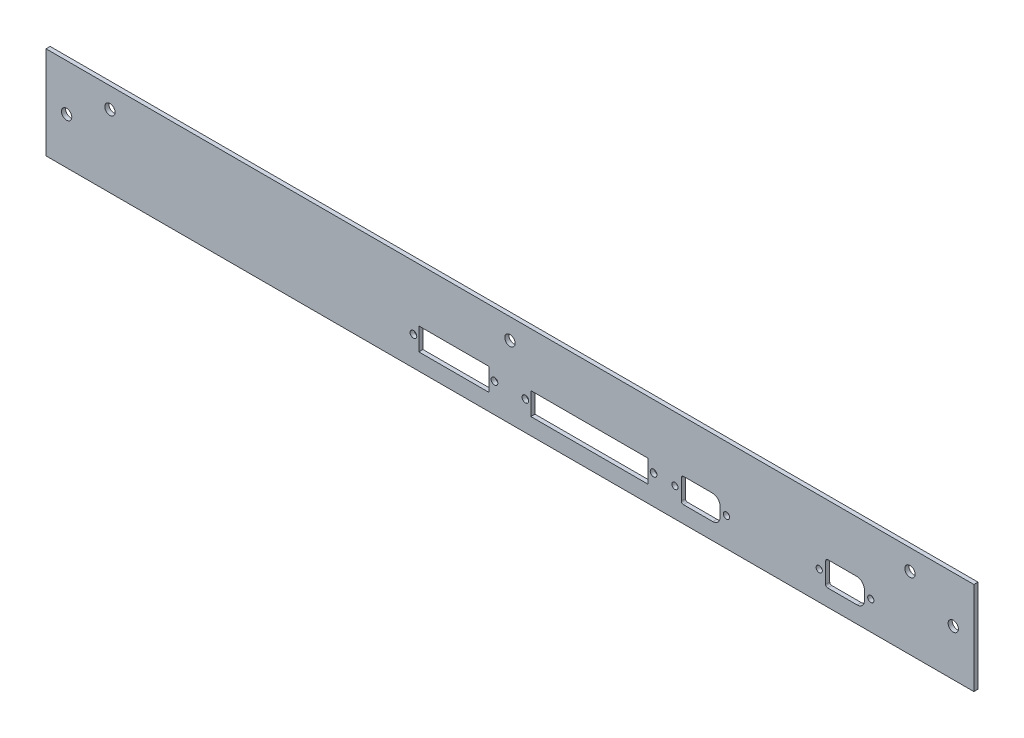
from build123d import *

# Parameters (mm, degrees)
SKETCH1_W                      = 450
SKETCH1_H                      = 45
BOSS_EXTRUDE1_DEPTH            = 2
TERMINAL_12P_CUTOUT_DEPTH      = 227.131046077
TERMINAL_12P_CUTOUT_DEPTH_BACK = 227.131046077
SK_TERMINAL_12P_CUTOUT_R       = 1.625
SK_TERMINAL_12P_CUTOUT_W       = 56.92
SK_TERMINAL_12P_CUTOUT_H       = 10.9
SK_TERMINAL_12P_CUTOUT_W_2     = 34.06
SKETCH2_R                      = 2.5
CUT_EXTRUDE1_DEPTH             = 227.131046077
SKETCH3_R                      = 1.5
CUT_EXTRUDE2_DEPTH             = 10


with BuildPart() as part:
    # Sketch1 → Boss-Extrude1 (new body)
    with BuildSketch(Plane.XY):
        Rectangle(SKETCH1_W, SKETCH1_H)
    extrude(amount=BOSS_EXTRUDE1_DEPTH)

    # SK Terminal 12P cutout → Terminal 12P cutout (cut, two sides: drawn at the far end of the back side and taken through both)
    with BuildSketch(Plane.XY.offset(-TERMINAL_12P_CUTOUT_DEPTH_BACK)):
        with Locations((7.5, -8.35)):
            Circle(SK_TERMINAL_12P_CUTOUT_R)
        with Locations((69.67, -8.35)):
            Circle(SK_TERMINAL_12P_CUTOUT_R)
        with Locations((-46.81, -8.35)):
            Circle(SK_TERMINAL_12P_CUTOUT_R)
        with Locations((-7.5, -8.35)):
            Circle(SK_TERMINAL_12P_CUTOUT_R)
        with Locations((38.585, -8.95)):
            Rectangle(SK_TERMINAL_12P_CUTOUT_W, SK_TERMINAL_12P_CUTOUT_H)
        with Locations((-27.155, -8.95)):
            Rectangle(SK_TERMINAL_12P_CUTOUT_W_2, SK_TERMINAL_12P_CUTOUT_H)
    extrude(amount=TERMINAL_12P_CUTOUT_DEPTH + TERMINAL_12P_CUTOUT_DEPTH_BACK, mode=Mode.SUBTRACT)

    # Sketch2 → Cut-Extrude1 (cut, through all)
    with BuildSketch(Plane.XY.offset(2)):
        with Locations((-215, 0)):
            Circle(SKETCH2_R)
        with Locations((215, 0)):
            Circle(SKETCH2_R)
        with Locations((-194, 12.495407459)):
            Circle(SKETCH2_R)
        with Locations((194, 12.495407459)):
            Circle(SKETCH2_R)
        with Locations((0, 12.5)):
            Circle(SKETCH2_R)
    extrude(amount=-CUT_EXTRUDE1_DEPTH, mode=Mode.SUBTRACT)

    # Sketch3 → Cut-Extrude2 (cut)
    with BuildSketch(Plane.XY.offset(2)):
        with Locations((150, -8.55)):
            Circle(SKETCH3_R)
        with Locations((175, -8.55)):
            Circle(SKETCH3_R)
        with Locations((80, -8.55)):
            Circle(SKETCH3_R)
        with Locations((105, -8.55)):
            Circle(SKETCH3_R)
        with BuildLine():
            Line((168.375, -14.4), (154.1, -14.4))
            ThreePointArc((154.1, -14.4), (153.392893219, -14.107106781), (153.1, -13.4))
            Line((153.1, -13.4), (153.1, -3.7))
            ThreePointArc((153.1, -3.7), (153.451471863, -2.851471863), (154.3, -2.5))
            Line((154.3, -2.5), (168.175, -2.5))
            ThreePointArc((168.175, -2.5), (170.80897276, -3.59102724), (171.9, -6.225))
            Line((171.9, -6.225), (171.9, -10.875))
            ThreePointArc((171.9, -10.875), (170.867551404, -13.367551404), (168.375, -14.4))
        make_face()
        with BuildLine():
            Line((98.375, -14.4), (84.1, -14.4))
            ThreePointArc((84.1, -14.4), (83.392893219, -14.107106781), (83.1, -13.4))
            Line((83.1, -13.4), (83.1, -3.7))
            ThreePointArc((83.1, -3.7), (83.451471863, -2.851471863), (84.3, -2.5))
            Line((84.3, -2.5), (98.175, -2.5))
            ThreePointArc((98.175, -2.5), (100.80897276, -3.59102724), (101.9, -6.225))
            Line((101.9, -6.225), (101.9, -10.875))
            ThreePointArc((101.9, -10.875), (100.867551404, -13.367551404), (98.375, -14.4))
        make_face()
    extrude(amount=-CUT_EXTRUDE2_DEPTH, mode=Mode.SUBTRACT)


solid = part.part
